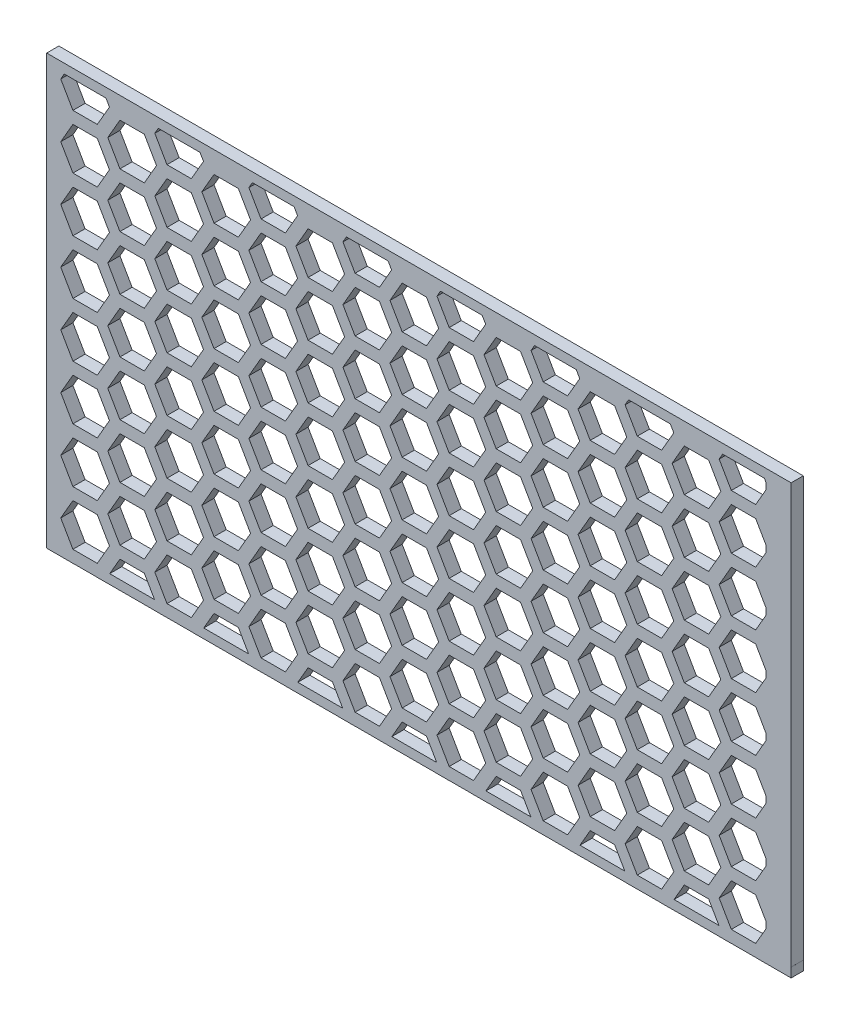
from build123d import *

# Parameters (mm, degrees)
SKETCH2_W           = 61.14
SKETCH2_H           = 35.22
BOSS_EXTRUDE1_DEPTH = 1
CUT_EXTRUDE6_DEPTH  = 10
LPATTERN8_COUNT     = 33
LPATTERN8_PITCH     = 4.46
LPATTERN9_DEPTH     = 1
LPATTERN10_DEPTH    = 1
SKETCH10_W          = 61.14
SKETCH10_H          = 1
BOSS_EXTRUDE5_DEPTH = 0.77
SKETCH12_W          = 61.14155306
SKETCH12_H          = 1
BOSS_EXTRUDE7_DEPTH = 0.77
SKETCH13_W          = 1
SKETCH13_H          = 35.22
BOSS_EXTRUDE8_DEPTH = 2.05


with BuildPart() as part:
    # Sketch2 → Boss-Extrude1 (new body)
    with BuildSketch(Plane.XY):
        Rectangle(SKETCH2_W, SKETCH2_H)
    extrude(amount=BOSS_EXTRUDE1_DEPTH)

    # Sketch7 → Cut-Extrude6 (cut)
    with BuildSketch(Plane.XY.offset(1)):
        Polygon((-28.415299462, -13.145898385), (-29.415299462, -14.877949192), (-28.415299462, -16.61), (-26.415299462, -16.61), (-25.415299462, -14.877949192), (-26.415299462, -13.145898385), align=None)
    cut_extrude6 = extrude(amount=-CUT_EXTRUDE6_DEPTH, mode=Mode.SUBTRACT)

    # LPattern8: Cut-Extrude6 ×33
    with Locations(*[Vector(0.8660254037844383, 0.5000000000000007, 0) * (i * LPATTERN8_PITCH) for i in range(1, LPATTERN8_COUNT)]):
        add(cut_extrude6, mode=Mode.SUBTRACT)

    # LPattern9: read off the stored shape, not the designer's step
    # LPattern9 outline → LPattern9 (cut)
    with BuildSketch(Plane.XY):
        Polygon((13.071906848, 14.112050808), (14.071906848, 12.38), (16.071906848, 12.38), (17.071906848, 14.112050808), (16.071906848, 15.844101615), (14.071906848, 15.844101615), align=None)
        Polygon((5.346960246, 14.112050808), (6.346960246, 12.38), (8.346960246, 12.38), (9.346960246, 14.112050808), (8.346960246, 15.844101615), (6.346960246, 15.844101615), align=None)
        Polygon((-2.377986355, 14.112050808), (-1.377986355, 12.38), (0.622013645, 12.38), (1.622013645, 14.112050808), (0.622013645, 15.844101615), (-1.377986355, 15.844101615), align=None)
        Polygon((-10.102932957, 14.112050808), (-9.102932957, 12.38), (-7.102932957, 12.38), (-6.102932957, 14.112050808), (-7.102932957, 15.844101615), (-9.102932957, 15.844101615), align=None)
        Polygon((-17.827879559, 14.112050808), (-16.827879559, 12.38), (-14.827879559, 12.38), (-13.827879559, 14.112050808), (-14.827879559, 15.844101615), (-16.827879559, 15.844101615), align=None)
        Polygon((-25.552826161, 14.112050808), (-24.552826161, 12.38), (-22.552826161, 12.38), (-21.552826161, 14.112050808), (-22.552826161, 15.844101615), (-24.552826161, 15.844101615), align=None)
        Polygon((16.516466555, 17.61), (13.627347141, 17.61), (14.071906848, 16.84), (16.071906848, 16.84), align=None)
        Polygon((-25.415299462, 16.342050808), (-26.147350269, 17.61), (-28.683248654, 17.61), (-29.415299462, 16.342050808), (-28.415299462, 14.61), (-26.415299462, 14.61), align=None)
        Polygon((-22.552826161, 16.84), (-22.108266453, 17.61), (-24.997385868, 17.61), (-24.552826161, 16.84), align=None)
        Polygon((-17.69035286, 16.342050808), (-18.422403667, 17.61), (-20.958302052, 17.61), (-21.69035286, 16.342050808), (-20.69035286, 14.61), (-18.69035286, 14.61), align=None)
        Polygon((-14.827879559, 16.84), (-14.383319852, 17.61), (-17.272439266, 17.61), (-16.827879559, 16.84), align=None)
        Polygon((-9.965406258, 16.342050808), (-10.697457066, 17.61), (-13.233355451, 17.61), (-13.965406258, 16.342050808), (-12.965406258, 14.61), (-10.965406258, 14.61), align=None)
        Polygon((-7.102932957, 16.84), (-6.65837325, 17.61), (-9.547492665, 17.61), (-9.102932957, 16.84), align=None)
        Polygon((-2.240459656, 16.342050808), (-2.972510464, 17.61), (-5.508408849, 17.61), (-6.240459656, 16.342050808), (-5.240459656, 14.61), (-3.240459656, 14.61), align=None)
        Polygon((0.622013645, 16.84), (1.066573352, 17.61), (-1.822546063, 17.61), (-1.377986355, 16.84), align=None)
        Polygon((5.484486945, 16.342050808), (4.752436138, 17.61), (2.216537753, 17.61), (1.484486945, 16.342050808), (2.484486945, 14.61), (4.484486945, 14.61), align=None)
        Polygon((8.346960246, 16.84), (8.791519954, 17.61), (5.902400539, 17.61), (6.346960246, 16.84), align=None)
        Polygon((13.209433547, 16.342050808), (12.47738274, 17.61), (9.941484355, 17.61), (9.209433547, 16.342050808), (10.209433547, 14.61), (12.209433547, 14.61), align=None)
        Polygon((24.241413157, 17.61), (21.352293743, 17.61), (21.79685345, 16.84), (23.79685345, 16.84), align=None)
        Polygon((20.202329341, 17.61), (17.666430956, 17.61), (16.934380149, 16.342050808), (17.934380149, 14.61), (19.934380149, 14.61), (20.934380149, 16.342050808), align=None)
        Polygon((9.209433547, 11.882050808), (10.209433547, 10.15), (12.209433547, 10.15), (13.209433547, 11.882050808), (12.209433547, 13.614101615), (10.209433547, 13.614101615), align=None)
        Polygon((1.484486945, 11.882050808), (2.484486945, 10.15), (4.484486945, 10.15), (5.484486945, 11.882050808), (4.484486945, 13.614101615), (2.484486945, 13.614101615), align=None)
        Polygon((-6.240459656, 11.882050808), (-5.240459656, 10.15), (-3.240459656, 10.15), (-2.240459656, 11.882050808), (-3.240459656, 13.614101615), (-5.240459656, 13.614101615), align=None)
        Polygon((-13.965406258, 11.882050808), (-12.965406258, 10.15), (-10.965406258, 10.15), (-9.965406258, 11.882050808), (-10.965406258, 13.614101615), (-12.965406258, 13.614101615), align=None)
        Polygon((-21.69035286, 11.882050808), (-20.69035286, 10.15), (-18.69035286, 10.15), (-17.69035286, 11.882050808), (-18.69035286, 13.614101615), (-20.69035286, 13.614101615), align=None)
        Polygon((-29.415299462, 11.882050808), (-28.415299462, 10.15), (-26.415299462, 10.15), (-25.415299462, 11.882050808), (-26.415299462, 13.614101615), (-28.415299462, 13.614101615), align=None)
        Polygon((5.346960246, 9.652050808), (6.346960246, 7.92), (8.346960246, 7.92), (9.346960246, 9.652050808), (8.346960246, 11.384101615), (6.346960246, 11.384101615), align=None)
        Polygon((-2.377986355, 9.652050808), (-1.377986355, 7.92), (0.622013645, 7.92), (1.622013645, 9.652050808), (0.622013645, 11.384101615), (-1.377986355, 11.384101615), align=None)
        Polygon((-10.102932957, 9.652050808), (-9.102932957, 7.92), (-7.102932957, 7.92), (-6.102932957, 9.652050808), (-7.102932957, 11.384101615), (-9.102932957, 11.384101615), align=None)
        Polygon((-17.827879559, 9.652050808), (-16.827879559, 7.92), (-14.827879559, 7.92), (-13.827879559, 9.652050808), (-14.827879559, 11.384101615), (-16.827879559, 11.384101615), align=None)
        Polygon((-25.552826161, 9.652050808), (-24.552826161, 7.92), (-22.552826161, 7.92), (-21.552826161, 9.652050808), (-22.552826161, 11.384101615), (-24.552826161, 11.384101615), align=None)
        Polygon((1.484486945, 7.422050808), (2.484486945, 5.69), (4.484486945, 5.69), (5.484486945, 7.422050808), (4.484486945, 9.154101615), (2.484486945, 9.154101615), align=None)
        Polygon((-6.240459656, 7.422050808), (-5.240459656, 5.69), (-3.240459656, 5.69), (-2.240459656, 7.422050808), (-3.240459656, 9.154101615), (-5.240459656, 9.154101615), align=None)
        Polygon((-13.965406258, 7.422050808), (-12.965406258, 5.69), (-10.965406258, 5.69), (-9.965406258, 7.422050808), (-10.965406258, 9.154101615), (-12.965406258, 9.154101615), align=None)
        Polygon((-21.69035286, 7.422050808), (-20.69035286, 5.69), (-18.69035286, 5.69), (-17.69035286, 7.422050808), (-18.69035286, 9.154101615), (-20.69035286, 9.154101615), align=None)
        Polygon((-29.415299462, 7.422050808), (-28.415299462, 5.69), (-26.415299462, 5.69), (-25.415299462, 7.422050808), (-26.415299462, 9.154101615), (-28.415299462, 9.154101615), align=None)
        Polygon((-2.377986355, 5.192050808), (-1.377986355, 3.46), (0.622013645, 3.46), (1.622013645, 5.192050808), (0.622013645, 6.924101615), (-1.377986355, 6.924101615), align=None)
        Polygon((-10.102932957, 5.192050808), (-9.102932957, 3.46), (-7.102932957, 3.46), (-6.102932957, 5.192050808), (-7.102932957, 6.924101615), (-9.102932957, 6.924101615), align=None)
        Polygon((-17.827879559, 5.192050808), (-16.827879559, 3.46), (-14.827879559, 3.46), (-13.827879559, 5.192050808), (-14.827879559, 6.924101615), (-16.827879559, 6.924101615), align=None)
        Polygon((-25.552826161, 5.192050808), (-24.552826161, 3.46), (-22.552826161, 3.46), (-21.552826161, 5.192050808), (-22.552826161, 6.924101615), (-24.552826161, 6.924101615), align=None)
        Polygon((-6.240459656, 2.962050808), (-5.240459656, 1.23), (-3.240459656, 1.23), (-2.240459656, 2.962050808), (-3.240459656, 4.694101615), (-5.240459656, 4.694101615), align=None)
        Polygon((-13.965406258, 2.962050808), (-12.965406258, 1.23), (-10.965406258, 1.23), (-9.965406258, 2.962050808), (-10.965406258, 4.694101615), (-12.965406258, 4.694101615), align=None)
        Polygon((-21.69035286, 2.962050808), (-20.69035286, 1.23), (-18.69035286, 1.23), (-17.69035286, 2.962050808), (-18.69035286, 4.694101615), (-20.69035286, 4.694101615), align=None)
        Polygon((-29.415299462, 2.962050808), (-28.415299462, 1.23), (-26.415299462, 1.23), (-25.415299462, 2.962050808), (-26.415299462, 4.694101615), (-28.415299462, 4.694101615), align=None)
        Polygon((-10.102932957, 0.732050808), (-9.102932957, -1), (-7.102932957, -1), (-6.102932957, 0.732050808), (-7.102932957, 2.464101615), (-9.102932957, 2.464101615), align=None)
        Polygon((-17.827879559, 0.732050808), (-16.827879559, -1), (-14.827879559, -1), (-13.827879559, 0.732050808), (-14.827879559, 2.464101615), (-16.827879559, 2.464101615), align=None)
        Polygon((-25.552826161, 0.732050808), (-24.552826161, -1), (-22.552826161, -1), (-21.552826161, 0.732050808), (-22.552826161, 2.464101615), (-24.552826161, 2.464101615), align=None)
        Polygon((-13.965406258, -1.497949192), (-12.965406258, -3.23), (-10.965406258, -3.23), (-9.965406258, -1.497949192), (-10.965406258, 0.234101615), (-12.965406258, 0.234101615), align=None)
        Polygon((-21.69035286, -1.497949192), (-20.69035286, -3.23), (-18.69035286, -3.23), (-17.69035286, -1.497949192), (-18.69035286, 0.234101615), (-20.69035286, 0.234101615), align=None)
        Polygon((-29.415299462, -1.497949192), (-28.415299462, -3.23), (-26.415299462, -3.23), (-25.415299462, -1.497949192), (-26.415299462, 0.234101615), (-28.415299462, 0.234101615), align=None)
        Polygon((-17.827879559, -3.727949192), (-16.827879559, -5.46), (-14.827879559, -5.46), (-13.827879559, -3.727949192), (-14.827879559, -1.995898385), (-16.827879559, -1.995898385), align=None)
        Polygon((-25.552826161, -3.727949192), (-24.552826161, -5.46), (-22.552826161, -5.46), (-21.552826161, -3.727949192), (-22.552826161, -1.995898385), (-24.552826161, -1.995898385), align=None)
        Polygon((-21.69035286, -5.957949192), (-20.69035286, -7.69), (-18.69035286, -7.69), (-17.69035286, -5.957949192), (-18.69035286, -4.225898385), (-20.69035286, -4.225898385), align=None)
        Polygon((-29.415299462, -5.957949192), (-28.415299462, -7.69), (-26.415299462, -7.69), (-25.415299462, -5.957949192), (-26.415299462, -4.225898385), (-28.415299462, -4.225898385), align=None)
        Polygon((-25.552826161, -8.187949192), (-24.552826161, -9.92), (-22.552826161, -9.92), (-21.552826161, -8.187949192), (-22.552826161, -6.455898385), (-24.552826161, -6.455898385), align=None)
        Polygon((-25.415299462, -10.417949192), (-26.415299462, -8.685898385), (-28.415299462, -8.685898385), (-29.415299462, -10.417949192), (-28.415299462, -12.15), (-26.415299462, -12.15), align=None)
    extrude(amount=LPATTERN9_DEPTH, mode=Mode.SUBTRACT)

    # LPattern10: read off the stored shape, not the designer's step
    # LPattern10 outline → LPattern10 (cut)
    with BuildSketch(Plane.XY):
        Polygon((19.934380149, 9.154101615), (17.934380149, 9.154101615), (16.934380149, 7.422050808), (17.934380149, 5.69), (19.934380149, 5.69), (20.934380149, 7.422050808), align=None)
        Polygon((16.071906848, 2.464101615), (14.071906848, 2.464101615), (13.071906848, 0.732050808), (14.071906848, -1), (16.071906848, -1), (17.071906848, 0.732050808), align=None)
        Polygon((12.209433547, -4.225898385), (10.209433547, -4.225898385), (9.209433547, -5.957949192), (10.209433547, -7.69), (12.209433547, -7.69), (13.209433547, -5.957949192), align=None)
        Polygon((8.346960246, -10.915898385), (6.346960246, -10.915898385), (5.346960246, -12.647949192), (6.346960246, -14.38), (8.346960246, -14.38), (9.346960246, -12.647949192), align=None)
        Polygon((4.484486945, -17.605898385), (2.484486945, -17.605898385), (2.482118877, -17.61), (4.486855014, -17.61), align=None)
        Polygon((29.521800052, 12.38), (30.57, 12.38), (30.57, 15.844101615), (29.521800052, 15.844101615), (28.521800052, 14.112050808), align=None)
        Polygon((29.521800052, 7.92), (30.57, 7.92), (30.57, 11.384101615), (29.521800052, 11.384101615), (28.521800052, 9.652050808), align=None)
        Polygon((29.521800052, 3.46), (30.57, 3.46), (30.57, 6.924101615), (29.521800052, 6.924101615), (28.521800052, 5.192050808), align=None)
        Polygon((29.521800052, -1), (30.57, -1), (30.57, 2.464101615), (29.521800052, 2.464101615), (28.521800052, 0.732050808), align=None)
        Polygon((29.521800052, -5.46), (30.57, -5.46), (30.57, -1.995898385), (29.521800052, -1.995898385), (28.521800052, -3.727949192), align=None)
        Polygon((29.521800052, -9.92), (30.57, -9.92), (30.57, -6.455898385), (29.521800052, -6.455898385), (28.521800052, -8.187949192), align=None)
        Polygon((29.521800052, -14.38), (30.57, -14.38), (30.57, -10.915898385), (29.521800052, -10.915898385), (28.521800052, -12.647949192), align=None)
        Polygon((28.521800052, -17.107949192), (28.81165922, -17.61), (30.57, -17.61), (30.57, -15.375898385), (29.521800052, -15.375898385), align=None)
        Polygon((25.659326751, -17.605898385), (25.656958682, -17.61), (27.661694819, -17.61), (27.659326751, -17.605898385), align=None)
        Polygon((20.79685345, -17.107949192), (21.086712619, -17.61), (24.506994281, -17.61), (24.79685345, -17.107949192), (23.79685345, -15.375898385), (21.79685345, -15.375898385), align=None)
        Polygon((17.934380149, -17.605898385), (17.93201208, -17.61), (19.936748218, -17.61), (19.934380149, -17.605898385), align=None)
        Polygon((13.071906848, -17.107949192), (13.361766017, -17.61), (16.782047679, -17.61), (17.071906848, -17.107949192), (16.071906848, -15.375898385), (14.071906848, -15.375898385), align=None)
        Polygon((10.209433547, -17.605898385), (10.207065479, -17.61), (12.211801616, -17.61), (12.209433547, -17.605898385), align=None)
        Polygon((5.346960246, -17.107949192), (5.636819415, -17.61), (9.057101077, -17.61), (9.346960246, -17.107949192), (8.346960246, -15.375898385), (6.346960246, -15.375898385), align=None)
        Polygon((-28.41766753, -17.61), (-26.412931393, -17.61), (-26.415299462, -17.605898385), (-28.415299462, -17.605898385), align=None)
        Polygon((-25.262966992, -17.61), (-21.84268533, -17.61), (-21.552826161, -17.107949192), (-22.552826161, -15.375898385), (-24.552826161, -15.375898385), (-25.552826161, -17.107949192), align=None)
        Polygon((-20.692720928, -17.61), (-18.687984791, -17.61), (-18.69035286, -17.605898385), (-20.69035286, -17.605898385), align=None)
        Polygon((-17.53802039, -17.61), (-14.117738728, -17.61), (-13.827879559, -17.107949192), (-14.827879559, -15.375898385), (-16.827879559, -15.375898385), (-17.827879559, -17.107949192), align=None)
        Polygon((-12.967774327, -17.61), (-10.96303819, -17.61), (-10.965406258, -17.605898385), (-12.965406258, -17.605898385), align=None)
        Polygon((-9.813073788, -17.61), (-6.392792126, -17.61), (-6.102932957, -17.107949192), (-7.102932957, -15.375898385), (-9.102932957, -15.375898385), (-10.102932957, -17.107949192), align=None)
        Polygon((-5.242827725, -17.61), (-3.238091588, -17.61), (-3.240459656, -17.605898385), (-5.240459656, -17.605898385), align=None)
        Polygon((-2.088127187, -17.61), (1.332154476, -17.61), (1.622013645, -17.107949192), (0.622013645, -15.375898385), (-1.377986355, -15.375898385), (-2.377986355, -17.107949192), align=None)
        Polygon((25.659326751, 9.154101615), (24.659326751, 7.422050808), (25.659326751, 5.69), (27.659326751, 5.69), (28.659326751, 7.422050808), (27.659326751, 9.154101615), align=None)
        Polygon((16.071906848, 6.924101615), (14.071906848, 6.924101615), (13.071906848, 5.192050808), (14.071906848, 3.46), (16.071906848, 3.46), (17.071906848, 5.192050808), align=None)
        Polygon((12.209433547, 0.234101615), (10.209433547, 0.234101615), (9.209433547, -1.497949192), (10.209433547, -3.23), (12.209433547, -3.23), (13.209433547, -1.497949192), align=None)
        Polygon((8.346960246, -6.455898385), (6.346960246, -6.455898385), (5.346960246, -8.187949192), (6.346960246, -9.92), (8.346960246, -9.92), (9.346960246, -8.187949192), align=None)
        Polygon((4.484486945, -13.145898385), (2.484486945, -13.145898385), (1.484486945, -14.877949192), (2.484486945, -16.61), (4.484486945, -16.61), (5.484486945, -14.877949192), align=None)
        Polygon((21.79685345, 6.924101615), (20.79685345, 5.192050808), (21.79685345, 3.46), (23.79685345, 3.46), (24.79685345, 5.192050808), (23.79685345, 6.924101615), align=None)
        Polygon((25.659326751, 0.234101615), (24.659326751, -1.497949192), (25.659326751, -3.23), (27.659326751, -3.23), (28.659326751, -1.497949192), (27.659326751, 0.234101615), align=None)
        Polygon((24.659326751, 11.882050808), (25.659326751, 10.15), (27.659326751, 10.15), (28.659326751, 11.882050808), (27.659326751, 13.614101615), (25.659326751, 13.614101615), align=None)
        Polygon((12.209433547, 4.694101615), (10.209433547, 4.694101615), (9.209433547, 2.962050808), (10.209433547, 1.23), (12.209433547, 1.23), (13.209433547, 2.962050808), align=None)
        Polygon((8.346960246, -1.995898385), (6.346960246, -1.995898385), (5.346960246, -3.727949192), (6.346960246, -5.46), (8.346960246, -5.46), (9.346960246, -3.727949192), align=None)
        Polygon((4.484486945, -8.685898385), (2.484486945, -8.685898385), (1.484486945, -10.417949192), (2.484486945, -12.15), (4.484486945, -12.15), (5.484486945, -10.417949192), align=None)
        Polygon((17.934380149, 4.694101615), (16.934380149, 2.962050808), (17.934380149, 1.23), (19.934380149, 1.23), (20.934380149, 2.962050808), (19.934380149, 4.694101615), align=None)
        Polygon((21.79685345, -1.995898385), (20.79685345, -3.727949192), (21.79685345, -5.46), (23.79685345, -5.46), (24.79685345, -3.727949192), (23.79685345, -1.995898385), align=None)
        Polygon((25.659326751, -8.685898385), (24.659326751, -10.417949192), (25.659326751, -12.15), (27.659326751, -12.15), (28.659326751, -10.417949192), (27.659326751, -8.685898385), align=None)
        Polygon((20.79685345, 9.652050808), (21.79685345, 7.92), (23.79685345, 7.92), (24.79685345, 9.652050808), (23.79685345, 11.384101615), (21.79685345, 11.384101615), align=None)
        Polygon((8.346960246, 2.464101615), (6.346960246, 2.464101615), (5.346960246, 0.732050808), (6.346960246, -1), (8.346960246, -1), (9.346960246, 0.732050808), align=None)
        Polygon((4.484486945, -4.225898385), (2.484486945, -4.225898385), (1.484486945, -5.957949192), (2.484486945, -7.69), (4.484486945, -7.69), (5.484486945, -5.957949192), align=None)
        Polygon((0.622013645, -10.915898385), (-1.377986355, -10.915898385), (-2.377986355, -12.647949192), (-1.377986355, -14.38), (0.622013645, -14.38), (1.622013645, -12.647949192), align=None)
        Polygon((17.934380149, -4.225898385), (16.934380149, -5.957949192), (17.934380149, -7.69), (19.934380149, -7.69), (20.934380149, -5.957949192), (19.934380149, -4.225898385), align=None)
        Polygon((21.79685345, -10.915898385), (20.79685345, -12.647949192), (21.79685345, -14.38), (23.79685345, -14.38), (24.79685345, -12.647949192), (23.79685345, -10.915898385), align=None)
        Polygon((4.484486945, 0.234101615), (2.484486945, 0.234101615), (1.484486945, -1.497949192), (2.484486945, -3.23), (4.484486945, -3.23), (5.484486945, -1.497949192), align=None)
        Polygon((0.622013645, -6.455898385), (-1.377986355, -6.455898385), (-2.377986355, -8.187949192), (-1.377986355, -9.92), (0.622013645, -9.92), (1.622013645, -8.187949192), align=None)
        Polygon((-3.240459656, -13.145898385), (-5.240459656, -13.145898385), (-6.240459656, -14.877949192), (-5.240459656, -16.61), (-3.240459656, -16.61), (-2.240459656, -14.877949192), align=None)
        Polygon((14.071906848, -6.455898385), (13.071906848, -8.187949192), (14.071906848, -9.92), (16.071906848, -9.92), (17.071906848, -8.187949192), (16.071906848, -6.455898385), align=None)
        Polygon((17.934380149, -13.145898385), (16.934380149, -14.877949192), (17.934380149, -16.61), (19.934380149, -16.61), (20.934380149, -14.877949192), (19.934380149, -13.145898385), align=None)
        Polygon((0.622013645, -1.995898385), (-1.377986355, -1.995898385), (-2.377986355, -3.727949192), (-1.377986355, -5.46), (0.622013645, -5.46), (1.622013645, -3.727949192), align=None)
        Polygon((-3.240459656, -8.685898385), (-5.240459656, -8.685898385), (-6.240459656, -10.417949192), (-5.240459656, -12.15), (-3.240459656, -12.15), (-2.240459656, -10.417949192), align=None)
        Polygon((10.209433547, -8.685898385), (9.209433547, -10.417949192), (10.209433547, -12.15), (12.209433547, -12.15), (13.209433547, -10.417949192), (12.209433547, -8.685898385), align=None)
        Polygon((24.659326751, 2.962050808), (25.659326751, 1.23), (27.659326751, 1.23), (28.659326751, 2.962050808), (27.659326751, 4.694101615), (25.659326751, 4.694101615), align=None)
        Polygon((-3.240459656, -4.225898385), (-5.240459656, -4.225898385), (-6.240459656, -5.957949192), (-5.240459656, -7.69), (-3.240459656, -7.69), (-2.240459656, -5.957949192), align=None)
        Polygon((-7.102932957, -10.915898385), (-9.102932957, -10.915898385), (-10.102932957, -12.647949192), (-9.102932957, -14.38), (-7.102932957, -14.38), (-6.102932957, -12.647949192), align=None)
        Polygon((20.79685345, 0.732050808), (21.79685345, -1), (23.79685345, -1), (24.79685345, 0.732050808), (23.79685345, 2.464101615), (21.79685345, 2.464101615), align=None)
        Polygon((-7.102932957, -6.455898385), (-9.102932957, -6.455898385), (-10.102932957, -8.187949192), (-9.102932957, -9.92), (-7.102932957, -9.92), (-6.102932957, -8.187949192), align=None)
        Polygon((-10.965406258, -13.145898385), (-12.965406258, -13.145898385), (-13.965406258, -14.877949192), (-12.965406258, -16.61), (-10.965406258, -16.61), (-9.965406258, -14.877949192), align=None)
        Polygon((16.934380149, -1.497949192), (17.934380149, -3.23), (19.934380149, -3.23), (20.934380149, -1.497949192), (19.934380149, 0.234101615), (17.934380149, 0.234101615), align=None)
        Polygon((-10.965406258, -8.685898385), (-12.965406258, -8.685898385), (-13.965406258, -10.417949192), (-12.965406258, -12.15), (-10.965406258, -12.15), (-9.965406258, -10.417949192), align=None)
        Polygon((13.071906848, -3.727949192), (14.071906848, -5.46), (16.071906848, -5.46), (17.071906848, -3.727949192), (16.071906848, -1.995898385), (14.071906848, -1.995898385), align=None)
        Polygon((-14.827879559, -10.915898385), (-16.827879559, -10.915898385), (-17.827879559, -12.647949192), (-16.827879559, -14.38), (-14.827879559, -14.38), (-13.827879559, -12.647949192), align=None)
        Polygon((24.659326751, -5.957949192), (25.659326751, -7.69), (27.659326751, -7.69), (28.659326751, -5.957949192), (27.659326751, -4.225898385), (25.659326751, -4.225898385), align=None)
        Polygon((-18.69035286, -13.145898385), (-20.69035286, -13.145898385), (-21.69035286, -14.877949192), (-20.69035286, -16.61), (-18.69035286, -16.61), (-17.69035286, -14.877949192), align=None)
        Polygon((20.79685345, -8.187949192), (21.79685345, -9.92), (23.79685345, -9.92), (24.79685345, -8.187949192), (23.79685345, -6.455898385), (21.79685345, -6.455898385), align=None)
        Polygon((13.209433547, -14.877949192), (12.209433547, -13.145898385), (10.209433547, -13.145898385), (9.209433547, -14.877949192), (10.209433547, -16.61), (12.209433547, -16.61), align=None)
        Polygon((28.659326751, -14.877949192), (27.659326751, -13.145898385), (25.659326751, -13.145898385), (24.659326751, -14.877949192), (25.659326751, -16.61), (27.659326751, -16.61), align=None)
        Polygon((20.934380149, -10.417949192), (19.934380149, -8.685898385), (17.934380149, -8.685898385), (16.934380149, -10.417949192), (17.934380149, -12.15), (19.934380149, -12.15), align=None)
        Polygon((17.071906848, -12.647949192), (16.071906848, -10.915898385), (14.071906848, -10.915898385), (13.071906848, -12.647949192), (14.071906848, -14.38), (16.071906848, -14.38), align=None)
    extrude(amount=LPATTERN10_DEPTH, mode=Mode.SUBTRACT)

    # Sketch10 → Boss-Extrude5 (add)
    with BuildSketch(Plane(origin=(0, 17.61, 0), x_dir=(1, 0, 0), z_dir=(0, 1, 0))):
        with Locations((0, -0.5)):
            Rectangle(SKETCH10_W, SKETCH10_H)
    extrude(amount=-BOSS_EXTRUDE5_DEPTH)

    # Sketch12 → Boss-Extrude7 (add)
    with BuildSketch(Plane.XZ.offset(17.605898385)):
        with Locations((0.00077653, 0.5)):
            Rectangle(SKETCH12_W, SKETCH12_H)
    extrude(amount=-BOSS_EXTRUDE7_DEPTH)

    # Sketch13 → Boss-Extrude8 (add)
    with BuildSketch(Plane(origin=(30.57, 0, 0), x_dir=(0, 0, -1), z_dir=(1, 0, 0))):
        with Locations((-0.5, 0)):
            Rectangle(SKETCH13_W, SKETCH13_H)
    extrude(amount=-BOSS_EXTRUDE8_DEPTH)


solid = part.part
